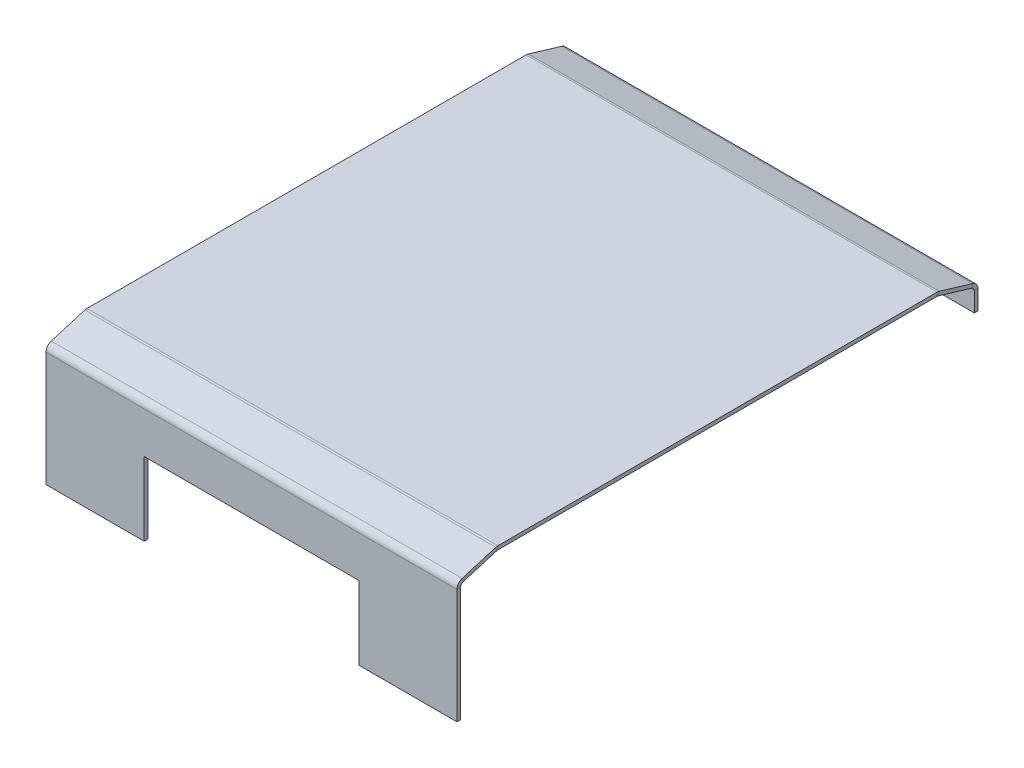
from build123d import *

# Parameters (mm, degrees)
BASE_FLANGE1_START = -279.99988
BASE_FLANGE1_DEPTH = 559.99976
SKETCH8_W          = 292.444779068
SKETCH8_H          = 100
CUT_EXTRUDE1_DEPTH = 898.788870169


# Sheet-metal steps are written as plain solids
with BuildPart() as part:
    # Sketch3 → Base-Flange1 (new body)
    with BuildSketch(Plane(origin=(-250, -934.739885498, -1517.780517475), x_dir=(0, 0, -1), z_dir=(1, 0, 0)).offset(BASE_FLANGE1_START)):
        with BuildLine():
            Line((-1517.780517475, 789.739945498), (-1517.780517475, 919.739945498))
            Line((-1517.780517475, 919.739945498), (-1517.780517475, 946.019792244))
            ThreePointArc((-1517.780517475, 946.019792244), (-1516.791982116, 949.004444892), (-1514.217256902, 950.80892367))
            Line((-1514.217256902, 950.80892367), (-1468.483412721, 964.529076924))
            ThreePointArc((-1468.483412721, 964.529076924), (-1467.772739017, 964.686947476), (-1467.046673293, 964.739945498))
            Line((-1467.046673293, 964.739945498), (-868.514361656, 964.739945498))
            ThreePointArc((-868.514361656, 964.739945498), (-867.788295933, 964.686947476), (-867.077622228, 964.529076924))
            Line((-867.077622228, 964.529076924), (-821.343778047, 950.80892367))
            ThreePointArc((-821.343778047, 950.80892367), (-818.769052833, 949.004444892), (-817.780517475, 946.019792244))
            Line((-817.780517475, 946.019792244), (-817.780517475, 919.739945498))
            Line((-817.780517475, 919.739945498), (-812.780517475, 919.739945498))
            Line((-812.780517475, 919.739945498), (-812.780517475, 946.019792244))
            ThreePointArc((-812.780517475, 946.019792244), (-814.757588192, 951.98909754), (-819.907038619, 955.598055096))
            Line((-819.907038619, 955.598055096), (-865.6408828, 969.318208351))
            ThreePointArc((-865.6408828, 969.31820835), (-867.062230209, 969.633949453), (-868.514361657, 969.739945498))
            Line((-868.514361656, 969.739945498), (-1467.046673293, 969.739945498))
            ThreePointArc((-1467.046673294, 969.739945498), (-1468.49880474, 969.633949453), (-1469.920152148, 969.318208351))
            Line((-1469.920152149, 969.318208351), (-1515.65399633, 955.598055096))
            ThreePointArc((-1515.65399633, 955.598055096), (-1520.803446757, 951.98909754), (-1522.780517475, 946.019792244))
            Line((-1522.780517475, 946.019792244), (-1522.780517475, 919.739945498))
            Line((-1522.780517475, 919.739945498), (-1522.780517475, 789.739945498))
            Line((-1522.780517475, 789.739945498), (-1517.780517475, 789.739945498))
        make_face()
    extrude(amount=BASE_FLANGE1_DEPTH)

    # Sketch8 → Cut-Extrude1 (cut, through all)
    with BuildSketch(Plane.XY.offset(5)):
        with Locations((-250, -94.99994)):
            Rectangle(SKETCH8_W, SKETCH8_H)
    extrude(amount=-CUT_EXTRUDE1_DEPTH, mode=Mode.SUBTRACT)


solid = part.part
